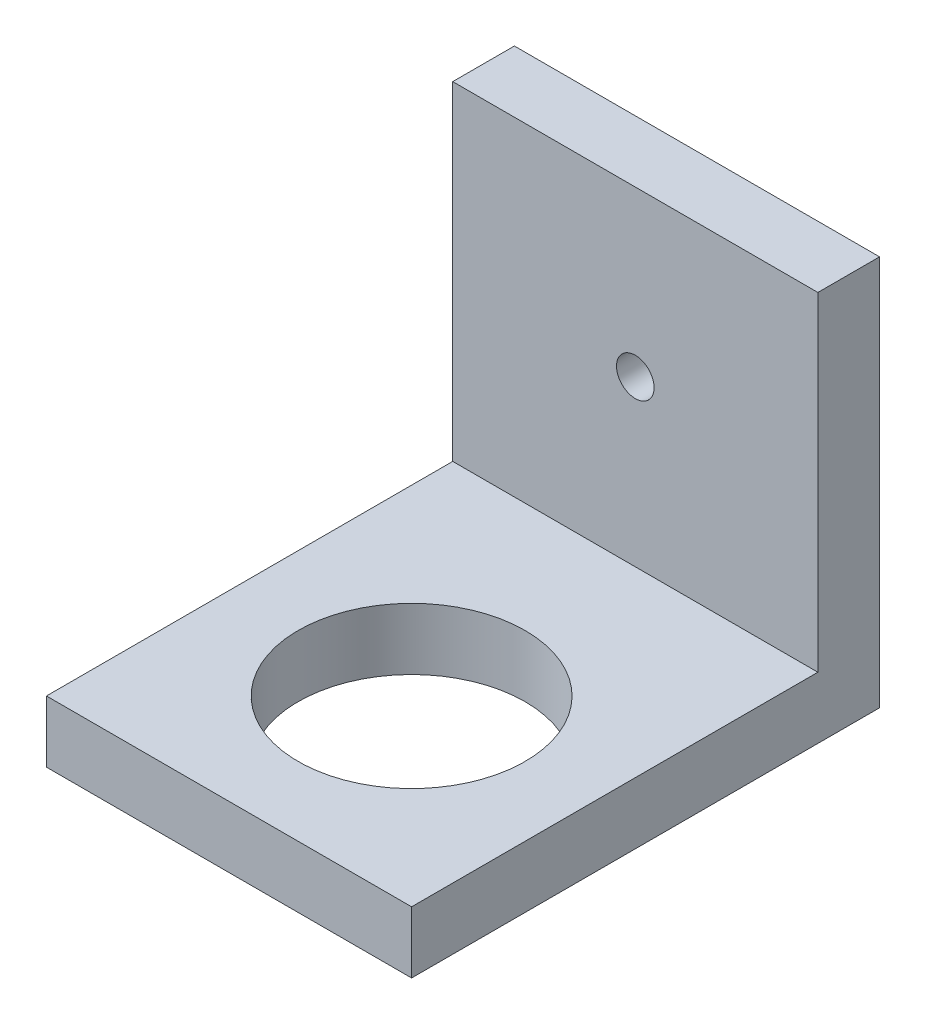
from build123d import *

# Parameters (mm, degrees)
SKETCH1_W              = 28.2
SKETCH1_H              = 36.1375
BOSS_EXTRUDE1_DEPTH    = 4.7625
SKETCH2_W              = 28.2
SKETCH2_H              = 4.7625
BOSS_EXTRUDE2_DEPTH    = 25.4
SKETCH3_R              = 8.763
CUT_EXTRUDE1_DEPTH     = 55.871990236
M2_5_CLEARANCE_HOLE2_D = 2.9


with BuildPart() as part:
    # Sketch1 → Boss-Extrude1 (new body)
    with BuildSketch(Plane(origin=(0, 0, 0), x_dir=(1, 0, 0), z_dir=(0, 1, 0))):
        with Locations((14.1, 18.06875)):
            Rectangle(SKETCH1_W, SKETCH1_H)
    extrude(amount=BOSS_EXTRUDE1_DEPTH)

    # Sketch2 → Boss-Extrude2 (add)
    with BuildSketch(Plane(origin=(0, 4.7625, 0), x_dir=(1, 0, 0), z_dir=(0, 1, 0))):
        with Locations((14.1, 33.75625)):
            Rectangle(SKETCH2_W, SKETCH2_H)
    extrude(amount=BOSS_EXTRUDE2_DEPTH)

    # Sketch3 → Cut-Extrude1 (cut, through all)
    with BuildSketch(Plane.XZ):
        with Locations((14.1, -14.1)):
            Circle(SKETCH3_R)
    extrude(amount=-CUT_EXTRUDE1_DEPTH, mode=Mode.SUBTRACT)

    # M2.5 Clearance Hole2 (through all)
    with Locations(Plane.XY.offset(-31.375)):
        with Locations((14.1, 17.4625)):
            Hole(M2_5_CLEARANCE_HOLE2_D / 2)


solid = part.part
